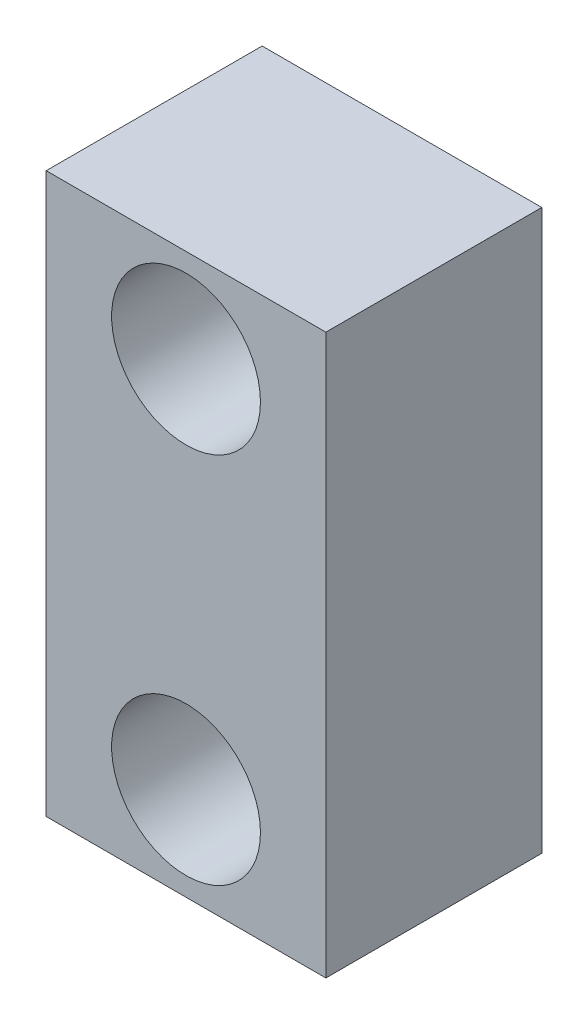
from build123d import *

# Parameters (mm, degrees)
SKETCH1_W           = 30
SKETCH1_H           = 60.00025276
SKETCH1_R           = 7.982312081
BOSS_EXTRUDE1_DEPTH = 23.1638


with BuildPart() as part:
    # Sketch1 → Boss-Extrude1 (new body)
    with BuildSketch(Plane.XY):
        with Locations((0, 20.00012638)):
            Rectangle(SKETCH1_W, SKETCH1_H)
        Circle(SKETCH1_R, mode=Mode.SUBTRACT)
        with Locations((0, 40.00025276)):
            Circle(SKETCH1_R, mode=Mode.SUBTRACT)
    extrude(amount=BOSS_EXTRUDE1_DEPTH)


solid = part.part
